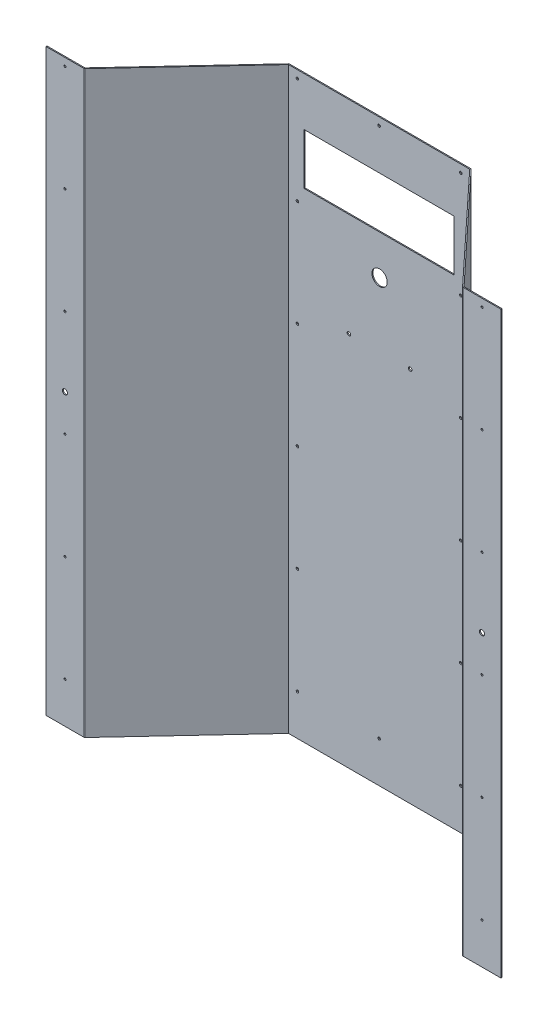
from build123d import *

# Parameters (mm, degrees)
SKETCH_1_W                         = 355
SKETCH_1_H                         = 1135
SM_BASE_FLANGE_2_DEPTH             = 2
SM_EDGE_FLANGE_1_STRIP_CUT_DEPTH   = 1135
SM_EDGE_FLANGE_1_STRIP_CUT_2_DEPTH = 1135
SM_EDGE_FLANGE_1_DEPTH             = 1135
SM_EDGE_FLANGE_1_BEND_DEPTH        = 1135
SM_EDGE_FLANGE_2_STRIP_CUT_DEPTH   = 1135
SM_EDGE_FLANGE_2_STRIP_CUT_2_DEPTH = 1135
SM_EDGE_FLANGE_2_DEPTH             = 1135
SM_EDGE_FLANGE_2_BEND_DEPTH        = 1135
CUT_EXTRUDE_1_REACH                = 1313.499
SKETCH_30_W                        = 294.35943441
SKETCH_30_H                        = 100
CUT_EXTRUDE_2_REACH                = 1313.182
SKETCH_31_R                        = 5
CUT_EXTRUDE_3_REACH                = 1313.182
SKETCH_32_R                        = 3.5
CUT_EXTRUDE_4_REACH                = 1313.182
SKETCH_33_R                        = 2.5
SKETCH_34_R                        = 15
CUT_EXTRUDE_5_DEPTH                = 1312.499391255
SKETCH_35_R                        = 2
CUT_EXTRUDE_6_DEPTH                = 1312.182199724


# Sheet-metal steps are written as plain solids
with BuildPart() as part:
    # Эскиз1 → Базовая кромка2 (new body)
    with BuildSketch(Plane.XY):
        with Locations((177.5, 567.5)):
            Rectangle(SKETCH_1_W, SKETCH_1_H)
    extrude(amount=-SM_BASE_FLANGE_2_DEPTH)

    # Ребро-кромка1 strip (across the edge) → Ребро-кромка1 strip cut (cut)
    with BuildSketch(Plane(origin=(0, 1135, 0), x_dir=(0.731353701619167, 0, 0.6819983600625024), z_dir=(0, -1, 0))):
        Polygon((-8.058016598, 4.77956712), (-1.129756712, -1.681139744), (0.234240008, -0.218432341), (-6.694019878, 6.242274523), align=None)
    extrude(amount=SM_EDGE_FLANGE_1_STRIP_CUT_DEPTH, mode=Mode.SUBTRACT)

    # Ребро-кромка1 strip 2 (across the edge) → Ребро-кромка1 strip cut 2 (cut)
    with BuildSketch(Plane(origin=(355, 0, 0), x_dir=(-0.731353701619167, 0, 0.6819983600625024), z_dir=(0, 1, 0))):
        Polygon((-8.058016598, 4.77956712), (-1.129756712, -1.681139744), (0.234240008, -0.218432341), (-6.694019878, 6.242274523), align=None)
    extrude(amount=SM_EDGE_FLANGE_1_STRIP_CUT_2_DEPTH, mode=Mode.SUBTRACT)

    # Ребро-кромка1 section (across the edge) → Ребро-кромка1 (add)
    with BuildSketch(Plane(origin=(0, 1135, 0), x_dir=(0.731353701619167, 0, 0.6819983600625024), z_dir=(0, -1, 0))):
        with BuildLine():
            Line((-2, 0.320282795), (-2, 282.13037525))
            Line((-2, 282.13037525), (0, 282.13037525))
            Line((0, 282.13037525), (0, 0.320282795))
            ThreePointArc((0, 0.320282795), (0.061093549, 0.026564231), (0.234240008, -0.218432341))
            Line((0.234240008, -0.218432341), (-1.129756712, -1.681139744))
            ThreePointArc((-1.129756712, -1.681139744), (-1.7730266, -0.770933907), (-2, 0.320282795))
        make_face()
    extrude(amount=SM_EDGE_FLANGE_1_DEPTH)

    # Ребро-кромка1 section 2 (across the edge) → Ребро-кромка1 bend (add)
    with BuildSketch(Plane(origin=(355, 0, 0), x_dir=(-0.731353701619167, 0, 0.6819983600625024), z_dir=(0, 1, 0))):
        with BuildLine():
            Line((-2, 0.320282795), (-2, 282.13037525))
            Line((-2, 282.13037525), (0, 282.13037525))
            Line((0, 282.13037525), (0, 0.320282795))
            ThreePointArc((0, 0.320282795), (0.061093549, 0.026564231), (0.234240008, -0.218432341))
            Line((0.234240008, -0.218432341), (-1.129756712, -1.681139744))
            ThreePointArc((-1.129756712, -1.681139744), (-1.7730266, -0.770933907), (-2, 0.320282795))
        make_face()
    extrude(amount=SM_EDGE_FLANGE_1_BEND_DEPTH)

    # Ребро-кромка2 strip (across the edge) → Ребро-кромка2 strip cut (cut)
    with BuildSketch(Plane(origin=(548.875160648, 1135, 204.973097558), x_dir=(0, 0, -1), z_dir=(0, -1, 0))):
        Polygon((-8.058016598, 4.77956712), (-1.129756712, -1.681139744), (0.234240008, -0.218432341), (-6.694019878, 6.242274523), align=None)
    extrude(amount=SM_EDGE_FLANGE_2_STRIP_CUT_DEPTH, mode=Mode.SUBTRACT)

    # Ребро-кромка2 strip 2 (across the edge) → Ребро-кромка2 strip cut 2 (cut)
    with BuildSketch(Plane(origin=(-193.875160648, 0, 204.973097558), x_dir=(0, 0, -1), z_dir=(0, 1, 0))):
        Polygon((-8.058016598, 4.77956712), (-1.129756712, -1.681139744), (0.234240008, -0.218432341), (-6.694019878, 6.242274523), align=None)
    extrude(amount=SM_EDGE_FLANGE_2_STRIP_CUT_2_DEPTH, mode=Mode.SUBTRACT)

    # Ребро-кромка2 section (across the edge) → Ребро-кромка2 (add)
    with BuildSketch(Plane(origin=(548.875160648, 1135, 204.973097558), x_dir=(0, 0, -1), z_dir=(0, -1, 0))):
        with BuildLine():
            Line((-2, 0.320282795), (-2, 74.13037525))
            Line((-2, 74.13037525), (0, 74.13037525))
            Line((0, 74.13037525), (0, 0.320282795))
            ThreePointArc((0, 0.320282795), (0.061093549, 0.026564231), (0.234240008, -0.218432341))
            Line((0.234240008, -0.218432341), (-1.129756712, -1.681139744))
            ThreePointArc((-1.129756712, -1.681139744), (-1.7730266, -0.770933907), (-2, 0.320282795))
        make_face()
    extrude(amount=SM_EDGE_FLANGE_2_DEPTH)

    # Ребро-кромка2 section 2 (across the edge) → Ребро-кромка2 bend (add)
    with BuildSketch(Plane(origin=(-193.875160648, 0, 204.973097558), x_dir=(0, 0, -1), z_dir=(0, 1, 0))):
        with BuildLine():
            Line((-2, 0.320282795), (-2, 74.13037525))
            Line((-2, 74.13037525), (0, 74.13037525))
            Line((0, 74.13037525), (0, 0.320282795))
            ThreePointArc((0, 0.320282795), (0.061093549, 0.026564231), (0.234240008, -0.218432341))
            Line((0.234240008, -0.218432341), (-1.129756712, -1.681139744))
            ThreePointArc((-1.129756712, -1.681139744), (-1.7730266, -0.770933907), (-2, 0.320282795))
        make_face()
    extrude(amount=SM_EDGE_FLANGE_2_BEND_DEPTH)

    # Эскиз30 → Вырез-Вытянуть1 (cut, up to next)
    with BuildSketch(Plane(origin=(0, 0, -2), x_dir=(-1, 0, 0), z_dir=(0, 0, -1)), mode=Mode.PRIVATE) as cut_extrude_1_sk1:
        with Locations((-177.5, 990)):
            Rectangle(SKETCH_30_W, SKETCH_30_H)
    cut_extrude_1_tool1 = extrude(cut_extrude_1_sk1.sketch, amount=-CUT_EXTRUDE_1_REACH, mode=Mode.PRIVATE) & part.part
    add(cut_extrude_1_tool1.solids().sort_by_distance((177.5, 990, -2))[0], mode=Mode.SUBTRACT)

    # Эскиз31 → Вырез-Вытянуть2 (cut, up to next)
    with BuildSketch(Plane(origin=(0, 0, 204.973097558), x_dir=(-1, 0, 0), z_dir=(0, 0, -1)), mode=Mode.PRIVATE) as cut_extrude_2_sk1:
        with Locations((-586.020418971, 567.5)):
            Circle(SKETCH_31_R)
    cut_extrude_2_tool1 = extrude(cut_extrude_2_sk1.sketch, amount=-CUT_EXTRUDE_2_REACH, mode=Mode.PRIVATE) & part.part
    # Эскиз31 → Вырез-Вытянуть2 (cut, up to next)
    with BuildSketch(Plane(origin=(0, 0, 204.973097558), x_dir=(-1, 0, 0), z_dir=(0, 0, -1)), mode=Mode.PRIVATE) as cut_extrude_2_sk2:
        with Locations((231.10048967, 567.5)):
            Circle(SKETCH_31_R)
    cut_extrude_2_tool2 = extrude(cut_extrude_2_sk2.sketch, amount=-CUT_EXTRUDE_2_REACH, mode=Mode.PRIVATE) & part.part
    add(cut_extrude_2_tool1.solids().sort_by_distance((586.020419, 567.5, 204.973098))[0], mode=Mode.SUBTRACT)
    add(cut_extrude_2_tool2.solids().sort_by_distance((-231.10049, 567.5, 204.973098))[0], mode=Mode.SUBTRACT)

    # Эскиз32 → Вырез-Вытянуть3 (cut, up to next)
    with BuildSketch(Plane.XY, mode=Mode.PRIVATE) as cut_extrude_3_sk1:
        with Locations((118.320282795, 737.5)):
            Circle(SKETCH_32_R)
    cut_extrude_3_tool1 = extrude(cut_extrude_3_sk1.sketch, amount=-CUT_EXTRUDE_3_REACH, mode=Mode.PRIVATE) & part.part
    # Эскиз32 → Вырез-Вытянуть3 (cut, up to next)
    with BuildSketch(Plane.XY, mode=Mode.PRIVATE) as cut_extrude_3_sk2:
        with Locations((238.320282795, 737.5)):
            Circle(SKETCH_32_R)
    cut_extrude_3_tool2 = extrude(cut_extrude_3_sk2.sketch, amount=-CUT_EXTRUDE_3_REACH, mode=Mode.PRIVATE) & part.part
    add(cut_extrude_3_tool1.solids().sort_by_distance((118.320283, 737.5, 0))[0], mode=Mode.SUBTRACT)
    add(cut_extrude_3_tool2.solids().sort_by_distance((238.320283, 737.5, 0))[0], mode=Mode.SUBTRACT)

    # Эскиз33 → Вырез-Вытянуть4 (cut, up to next)
    with BuildSketch(Plane.XY, mode=Mode.PRIVATE) as cut_extrude_4_sk1:
        with Locations((17.505535898, 1120)):
            Circle(SKETCH_33_R)
    cut_extrude_4_tool1 = extrude(cut_extrude_4_sk1.sketch, amount=-CUT_EXTRUDE_4_REACH, mode=Mode.PRIVATE) & part.part
    # Эскиз33 → Вырез-Вытянуть4 (cut, up to next)
    with BuildSketch(Plane.XY, mode=Mode.PRIVATE) as cut_extrude_4_sk2:
        with Locations((177.505535898, 1120)):
            Circle(SKETCH_33_R)
    cut_extrude_4_tool2 = extrude(cut_extrude_4_sk2.sketch, amount=-CUT_EXTRUDE_4_REACH, mode=Mode.PRIVATE) & part.part
    # Эскиз33 → Вырез-Вытянуть4 (cut, up to next)
    with BuildSketch(Plane.XY, mode=Mode.PRIVATE) as cut_extrude_4_sk3:
        with Locations((337.505535898, 1120)):
            Circle(SKETCH_33_R)
    cut_extrude_4_tool3 = extrude(cut_extrude_4_sk3.sketch, amount=-CUT_EXTRUDE_4_REACH, mode=Mode.PRIVATE) & part.part
    # Эскиз33 → Вырез-Вытянуть4 (cut, up to next)
    with BuildSketch(Plane.XY, mode=Mode.PRIVATE) as cut_extrude_4_sk4:
        with Locations((17.505535898, 912)):
            Circle(SKETCH_33_R)
    cut_extrude_4_tool4 = extrude(cut_extrude_4_sk4.sketch, amount=-CUT_EXTRUDE_4_REACH, mode=Mode.PRIVATE) & part.part
    # Эскиз33 → Вырез-Вытянуть4 (cut, up to next)
    with BuildSketch(Plane.XY, mode=Mode.PRIVATE) as cut_extrude_4_sk5:
        with Locations((17.505535898, 704)):
            Circle(SKETCH_33_R)
    cut_extrude_4_tool5 = extrude(cut_extrude_4_sk5.sketch, amount=-CUT_EXTRUDE_4_REACH, mode=Mode.PRIVATE) & part.part
    # Эскиз33 → Вырез-Вытянуть4 (cut, up to next)
    with BuildSketch(Plane.XY, mode=Mode.PRIVATE) as cut_extrude_4_sk6:
        with Locations((17.505535898, 496)):
            Circle(SKETCH_33_R)
    cut_extrude_4_tool6 = extrude(cut_extrude_4_sk6.sketch, amount=-CUT_EXTRUDE_4_REACH, mode=Mode.PRIVATE) & part.part
    # Эскиз33 → Вырез-Вытянуть4 (cut, up to next)
    with BuildSketch(Plane.XY, mode=Mode.PRIVATE) as cut_extrude_4_sk7:
        with Locations((17.505535898, 288)):
            Circle(SKETCH_33_R)
    cut_extrude_4_tool7 = extrude(cut_extrude_4_sk7.sketch, amount=-CUT_EXTRUDE_4_REACH, mode=Mode.PRIVATE) & part.part
    # Эскиз33 → Вырез-Вытянуть4 (cut, up to next)
    with BuildSketch(Plane.XY, mode=Mode.PRIVATE) as cut_extrude_4_sk8:
        with Locations((17.505535898, 80)):
            Circle(SKETCH_33_R)
    cut_extrude_4_tool8 = extrude(cut_extrude_4_sk8.sketch, amount=-CUT_EXTRUDE_4_REACH, mode=Mode.PRIVATE) & part.part
    # Эскиз33 → Вырез-Вытянуть4 (cut, up to next)
    with BuildSketch(Plane.XY, mode=Mode.PRIVATE) as cut_extrude_4_sk9:
        with Locations((177.505535898, 80)):
            Circle(SKETCH_33_R)
    cut_extrude_4_tool9 = extrude(cut_extrude_4_sk9.sketch, amount=-CUT_EXTRUDE_4_REACH, mode=Mode.PRIVATE) & part.part
    # Эскиз33 → Вырез-Вытянуть4 (cut, up to next)
    with BuildSketch(Plane.XY, mode=Mode.PRIVATE) as cut_extrude_4_sk10:
        with Locations((337.505535898, 80)):
            Circle(SKETCH_33_R)
    cut_extrude_4_tool10 = extrude(cut_extrude_4_sk10.sketch, amount=-CUT_EXTRUDE_4_REACH, mode=Mode.PRIVATE) & part.part
    # Эскиз33 → Вырез-Вытянуть4 (cut, up to next)
    with BuildSketch(Plane.XY, mode=Mode.PRIVATE) as cut_extrude_4_sk11:
        with Locations((337.505535898, 496)):
            Circle(SKETCH_33_R)
    cut_extrude_4_tool11 = extrude(cut_extrude_4_sk11.sketch, amount=-CUT_EXTRUDE_4_REACH, mode=Mode.PRIVATE) & part.part
    # Эскиз33 → Вырез-Вытянуть4 (cut, up to next)
    with BuildSketch(Plane.XY, mode=Mode.PRIVATE) as cut_extrude_4_sk12:
        with Locations((337.505535898, 288)):
            Circle(SKETCH_33_R)
    cut_extrude_4_tool12 = extrude(cut_extrude_4_sk12.sketch, amount=-CUT_EXTRUDE_4_REACH, mode=Mode.PRIVATE) & part.part
    # Эскиз33 → Вырез-Вытянуть4 (cut, up to next)
    with BuildSketch(Plane.XY, mode=Mode.PRIVATE) as cut_extrude_4_sk13:
        with Locations((337.505535898, 704)):
            Circle(SKETCH_33_R)
    cut_extrude_4_tool13 = extrude(cut_extrude_4_sk13.sketch, amount=-CUT_EXTRUDE_4_REACH, mode=Mode.PRIVATE) & part.part
    # Эскиз33 → Вырез-Вытянуть4 (cut, up to next)
    with BuildSketch(Plane.XY, mode=Mode.PRIVATE) as cut_extrude_4_sk14:
        with Locations((337.505535898, 912)):
            Circle(SKETCH_33_R)
    cut_extrude_4_tool14 = extrude(cut_extrude_4_sk14.sketch, amount=-CUT_EXTRUDE_4_REACH, mode=Mode.PRIVATE) & part.part
    add(cut_extrude_4_tool1.solids().sort_by_distance((17.505536, 1120, 0))[0], mode=Mode.SUBTRACT)
    add(cut_extrude_4_tool2.solids().sort_by_distance((177.505536, 1120, 0))[0], mode=Mode.SUBTRACT)
    add(cut_extrude_4_tool3.solids().sort_by_distance((337.505536, 1120, 0))[0], mode=Mode.SUBTRACT)
    add(cut_extrude_4_tool4.solids().sort_by_distance((17.505536, 912, 0))[0], mode=Mode.SUBTRACT)
    add(cut_extrude_4_tool5.solids().sort_by_distance((17.505536, 704, 0))[0], mode=Mode.SUBTRACT)
    add(cut_extrude_4_tool6.solids().sort_by_distance((17.505536, 496, 0))[0], mode=Mode.SUBTRACT)
    add(cut_extrude_4_tool7.solids().sort_by_distance((17.505536, 288, 0))[0], mode=Mode.SUBTRACT)
    add(cut_extrude_4_tool8.solids().sort_by_distance((17.505536, 80, 0))[0], mode=Mode.SUBTRACT)
    add(cut_extrude_4_tool9.solids().sort_by_distance((177.505536, 80, 0))[0], mode=Mode.SUBTRACT)
    add(cut_extrude_4_tool10.solids().sort_by_distance((337.505536, 80, 0))[0], mode=Mode.SUBTRACT)
    add(cut_extrude_4_tool11.solids().sort_by_distance((337.505536, 496, 0))[0], mode=Mode.SUBTRACT)
    add(cut_extrude_4_tool12.solids().sort_by_distance((337.505536, 288, 0))[0], mode=Mode.SUBTRACT)
    add(cut_extrude_4_tool13.solids().sort_by_distance((337.505536, 704, 0))[0], mode=Mode.SUBTRACT)
    add(cut_extrude_4_tool14.solids().sort_by_distance((337.505536, 912, 0))[0], mode=Mode.SUBTRACT)

    # Эскиз34 → Вырез-Вытянуть5 (cut, through all)
    with BuildSketch(Plane(origin=(0, 0, -2), x_dir=(-1, 0, 0), z_dir=(0, 0, -1))):
        with Locations((-178.320282795, 862.5)):
            Circle(SKETCH_34_R)
    extrude(amount=-CUT_EXTRUDE_5_DEPTH, mode=Mode.SUBTRACT)

    # Эскиз35 → Вырез-Вытянуть6 (cut, through all)
    with BuildSketch(Plane(origin=(0, 0, 204.973097558), x_dir=(-1, 0, 0), z_dir=(0, 0, -1))):
        with Locations((-586.10048967, 1120)):
            Circle(SKETCH_35_R)
        with Locations((-586.10048967, 912)):
            Circle(SKETCH_35_R)
        with Locations((-586.10048967, 704)):
            Circle(SKETCH_35_R)
        with Locations((-586.10048967, 496)):
            Circle(SKETCH_35_R)
        with Locations((-586.10048967, 288)):
            Circle(SKETCH_35_R)
        with Locations((-586.10048967, 80)):
            Circle(SKETCH_35_R)
        with Locations((231.10048967, 80)):
            Circle(SKETCH_35_R)
        with Locations((231.10048967, 288)):
            Circle(SKETCH_35_R)
        with Locations((231.10048967, 496)):
            Circle(SKETCH_35_R)
        with Locations((231.10048967, 704)):
            Circle(SKETCH_35_R)
        with Locations((231.10048967, 912)):
            Circle(SKETCH_35_R)
        with Locations((231.10048967, 1120)):
            Circle(SKETCH_35_R)
    extrude(amount=-CUT_EXTRUDE_6_DEPTH, mode=Mode.SUBTRACT)


solid = part.part
